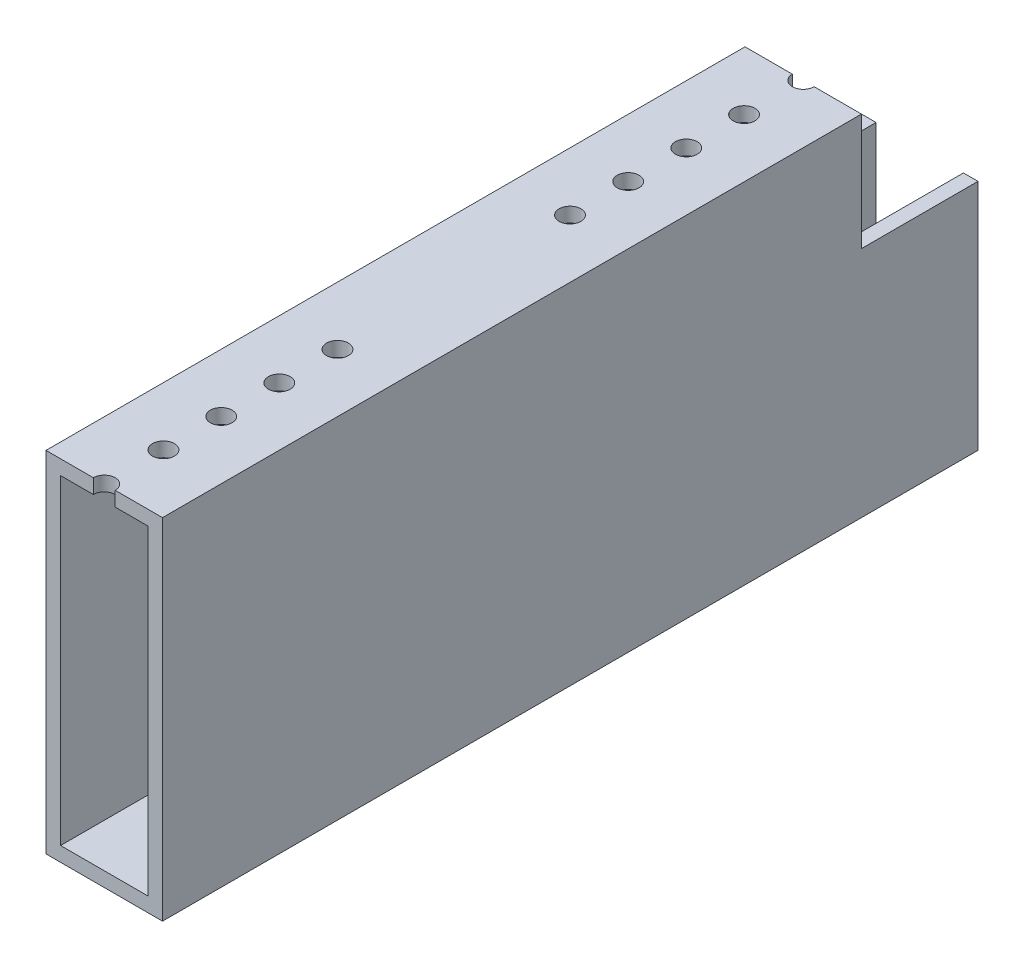
from build123d import *

# Parameters (mm, degrees)
SKETCH1_W           = 25.4
SKETCH1_H           = 76.2
BOSS_EXTRUDE1_DEPTH = 88.9
SHELL1_T            = -3.175
SKETCH2_W           = 25.4
SKETCH2_H           = 25.4
CUT_EXTRUDE1_DEPTH  = 100.9999
CUT_EXTRUDE2_REACH  = 119.775
SKETCH3_R           = 2.38125


with BuildPart() as part:
    # Sketch1 → Boss-Extrude1 (new, symmetric)
    with BuildSketch(Plane.XY):
        Rectangle(SKETCH1_W, SKETCH1_H)
    extrude(amount=BOSS_EXTRUDE1_DEPTH, both=True)

    # Shell1
    shell1_openings = [part.faces().sort_by_distance(p)[0] for p in [
        (0, 0, -88.9),
        (0, 0, 88.9),
    ]]
    offset(amount=SHELL1_T, openings=shell1_openings, kind=Kind.INTERSECTION)

    # Sketch2 → Cut-Extrude1 (cut, through all)
    with BuildSketch(Plane.ZY.offset(12.7)):
        with Locations((-76.2, 25.4)):
            Rectangle(SKETCH2_W, SKETCH2_H)
    extrude(amount=-CUT_EXTRUDE1_DEPTH, mode=Mode.SUBTRACT)

    # Sketch3 → Cut-Extrude2 (cut, up to next)
    with BuildSketch(Plane(origin=(0, 38.1, 0), x_dir=(1, 0, 0), z_dir=(0, 1, 0)), mode=Mode.PRIVATE) as cut_extrude2_sk1:
        with Locations((0, -88.9)):
            Circle(SKETCH3_R)
    cut_extrude2_tool1 = extrude(cut_extrude2_sk1.sketch, amount=-CUT_EXTRUDE2_REACH, mode=Mode.PRIVATE) & part.part
    # Sketch3 → Cut-Extrude2 (cut, up to next)
    with BuildSketch(Plane(origin=(0, 38.1, 0), x_dir=(1, 0, 0), z_dir=(0, 1, 0)), mode=Mode.PRIVATE) as cut_extrude2_sk2:
        with Locations((0, -75.995900078)):
            Circle(SKETCH3_R)
    cut_extrude2_tool2 = extrude(cut_extrude2_sk2.sketch, amount=-CUT_EXTRUDE2_REACH, mode=Mode.PRIVATE) & part.part
    # Sketch3 → Cut-Extrude2 (cut, up to next)
    with BuildSketch(Plane(origin=(0, 38.1, 0), x_dir=(1, 0, 0), z_dir=(0, 1, 0)), mode=Mode.PRIVATE) as cut_extrude2_sk3:
        with Locations((0, -63.397337518)):
            Circle(SKETCH3_R)
    cut_extrude2_tool3 = extrude(cut_extrude2_sk3.sketch, amount=-CUT_EXTRUDE2_REACH, mode=Mode.PRIVATE) & part.part
    # Sketch3 → Cut-Extrude2 (cut, up to next)
    with BuildSketch(Plane(origin=(0, 38.1, 0), x_dir=(1, 0, 0), z_dir=(0, 1, 0)), mode=Mode.PRIVATE) as cut_extrude2_sk4:
        with Locations((0, -50.731481722)):
            Circle(SKETCH3_R)
    cut_extrude2_tool4 = extrude(cut_extrude2_sk4.sketch, amount=-CUT_EXTRUDE2_REACH, mode=Mode.PRIVATE) & part.part
    # Sketch3 → Cut-Extrude2 (cut, up to next)
    with BuildSketch(Plane(origin=(0, 38.1, 0), x_dir=(1, 0, 0), z_dir=(0, 1, 0)), mode=Mode.PRIVATE) as cut_extrude2_sk5:
        with Locations((0, -38.048590908)):
            Circle(SKETCH3_R)
    cut_extrude2_tool5 = extrude(cut_extrude2_sk5.sketch, amount=-CUT_EXTRUDE2_REACH, mode=Mode.PRIVATE) & part.part
    # Sketch3 → Cut-Extrude2 (cut, up to next)
    with BuildSketch(Plane(origin=(0, 38.1, 0), x_dir=(1, 0, 0), z_dir=(0, 1, 0)), mode=Mode.PRIVATE) as cut_extrude2_sk6:
        with Locations((0, 63.5)):
            Circle(SKETCH3_R)
    cut_extrude2_tool6 = extrude(cut_extrude2_sk6.sketch, amount=-CUT_EXTRUDE2_REACH, mode=Mode.PRIVATE) & part.part
    # Sketch3 → Cut-Extrude2 (cut, up to next)
    with BuildSketch(Plane(origin=(0, 38.1, 0), x_dir=(1, 0, 0), z_dir=(0, 1, 0)), mode=Mode.PRIVATE) as cut_extrude2_sk7:
        with Locations((0, 12.648590908)):
            Circle(SKETCH3_R)
    cut_extrude2_tool7 = extrude(cut_extrude2_sk7.sketch, amount=-CUT_EXTRUDE2_REACH, mode=Mode.PRIVATE) & part.part
    # Sketch3 → Cut-Extrude2 (cut, up to next)
    with BuildSketch(Plane(origin=(0, 38.1, 0), x_dir=(1, 0, 0), z_dir=(0, 1, 0)), mode=Mode.PRIVATE) as cut_extrude2_sk8:
        with Locations((0, 25.331481722)):
            Circle(SKETCH3_R)
    cut_extrude2_tool8 = extrude(cut_extrude2_sk8.sketch, amount=-CUT_EXTRUDE2_REACH, mode=Mode.PRIVATE) & part.part
    # Sketch3 → Cut-Extrude2 (cut, up to next)
    with BuildSketch(Plane(origin=(0, 38.1, 0), x_dir=(1, 0, 0), z_dir=(0, 1, 0)), mode=Mode.PRIVATE) as cut_extrude2_sk9:
        with Locations((0, 37.997337518)):
            Circle(SKETCH3_R)
    cut_extrude2_tool9 = extrude(cut_extrude2_sk9.sketch, amount=-CUT_EXTRUDE2_REACH, mode=Mode.PRIVATE) & part.part
    # Sketch3 → Cut-Extrude2 (cut, up to next)
    with BuildSketch(Plane(origin=(0, 38.1, 0), x_dir=(1, 0, 0), z_dir=(0, 1, 0)), mode=Mode.PRIVATE) as cut_extrude2_sk10:
        with Locations((0, 50.595900078)):
            Circle(SKETCH3_R)
    cut_extrude2_tool10 = extrude(cut_extrude2_sk10.sketch, amount=-CUT_EXTRUDE2_REACH, mode=Mode.PRIVATE) & part.part
    add(cut_extrude2_tool1.solids().sort_by_distance((0, 38.1, 88.9))[0], mode=Mode.SUBTRACT)
    add(cut_extrude2_tool2.solids().sort_by_distance((0, 38.1, 75.9959))[0], mode=Mode.SUBTRACT)
    add(cut_extrude2_tool3.solids().sort_by_distance((0, 38.1, 63.397338))[0], mode=Mode.SUBTRACT)
    add(cut_extrude2_tool4.solids().sort_by_distance((0, 38.1, 50.731482))[0], mode=Mode.SUBTRACT)
    add(cut_extrude2_tool5.solids().sort_by_distance((0, 38.1, 38.048591))[0], mode=Mode.SUBTRACT)
    add(cut_extrude2_tool6.solids().sort_by_distance((0, 38.1, -63.5))[0], mode=Mode.SUBTRACT)
    add(cut_extrude2_tool7.solids().sort_by_distance((0, 38.1, -12.648591))[0], mode=Mode.SUBTRACT)
    add(cut_extrude2_tool8.solids().sort_by_distance((0, 38.1, -25.331482))[0], mode=Mode.SUBTRACT)
    add(cut_extrude2_tool9.solids().sort_by_distance((0, 38.1, -37.997338))[0], mode=Mode.SUBTRACT)
    add(cut_extrude2_tool10.solids().sort_by_distance((0, 38.1, -50.5959))[0], mode=Mode.SUBTRACT)


solid = part.part
